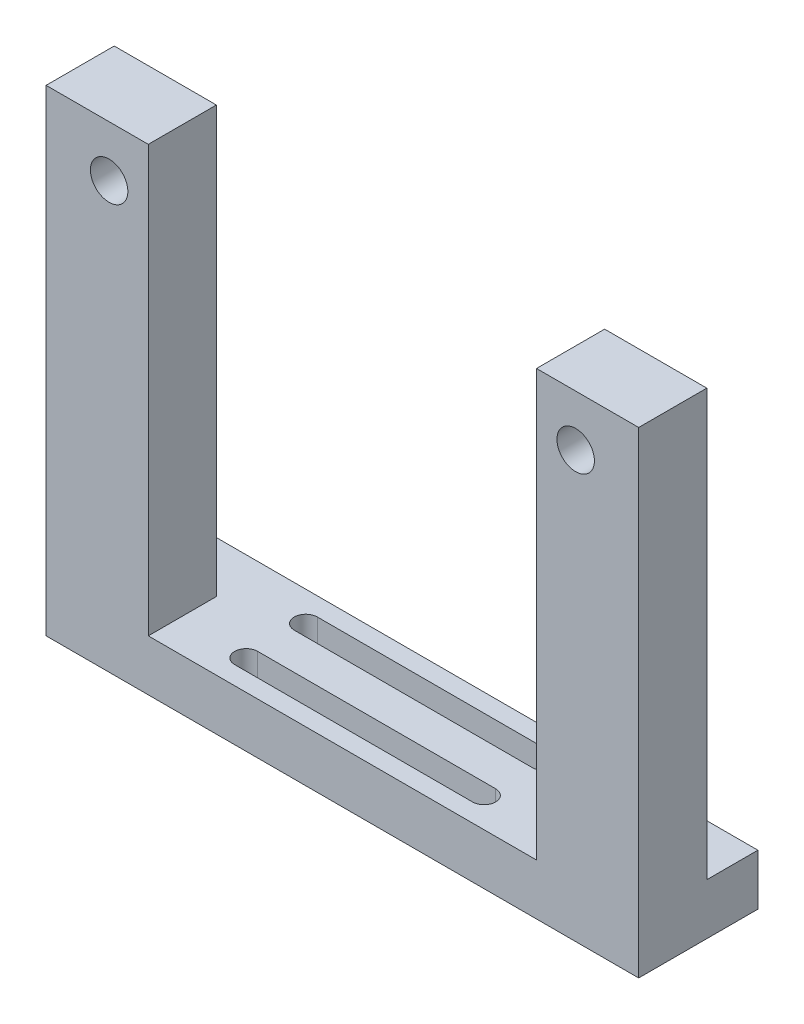
from build123d import *

# Parameters (mm, degrees)
EXTRUDE_1_DEPTH     = 4
SKETCH_3_R          = 1.1
CUT_EXTRUDE_2_DEPTH = 23.688322988
SKETCH_4_W          = 34.8
SKETCH_4_H          = 3
EXTRUDE_2_DEPTH     = 3
CUT_EXTRUDE_3_DEPTH = 31.720677076


with BuildPart() as part:
    # 草图1 → 凸台-拉伸1 (new body)
    with BuildSketch(Plane.XY):
        Polygon((-17.4, 14), (-17.4, -14), (17.4, -14), (17.4, 14), (11.4, 14), (11.4, -11), (-11.4, -11), (-11.4, 14), align=None)
    extrude(amount=EXTRUDE_1_DEPTH)

    # 草图3 → 切除-拉伸2 (cut, through all)
    with BuildSketch(Plane(origin=(0, 0, 0), x_dir=(-1, 0, 0), z_dir=(0, 0, -1))):
        with Locations((-13.7, 11)):
            Circle(SKETCH_3_R)
        with Locations((13.7, 11)):
            Circle(SKETCH_3_R)
    extrude(amount=-CUT_EXTRUDE_2_DEPTH, mode=Mode.SUBTRACT)

    # 草图4 → 凸台-拉伸2 (add)
    with BuildSketch(Plane.XZ.offset(14)):
        with Locations((0, -1.5)):
            Rectangle(SKETCH_4_W, SKETCH_4_H)
    extrude(amount=-EXTRUDE_2_DEPTH)

    # 草图5 → 切除-拉伸3 (cut, through all)
    with BuildSketch(Plane(origin=(0, -11, 0), x_dir=(1, 0, 0), z_dir=(0, 1, 0))):
        with BuildLine():
            Line((6.571482936, 0.575), (-7.4, 0.575))
            ThreePointArc((-7.4, 0.575), (-8.075, 1.25), (-7.4, 1.925))
            Line((-7.4, 1.925), (6.571482936, 1.925))
            ThreePointArc((6.571482936, 1.925), (7.246482936, 1.25), (6.571482936, 0.575))
        make_face()
        with BuildLine():
            Line((-7.4, -1.575), (6.571482936, -1.575))
            ThreePointArc((6.571482936, -1.575), (7.246482936, -2.25), (6.571482936, -2.925))
            Line((6.571482936, -2.925), (-7.4, -2.925))
            ThreePointArc((-7.4, -2.925), (-8.075, -2.25), (-7.4, -1.575))
        make_face()
    extrude(amount=-CUT_EXTRUDE_3_DEPTH, mode=Mode.SUBTRACT)


solid = part.part
